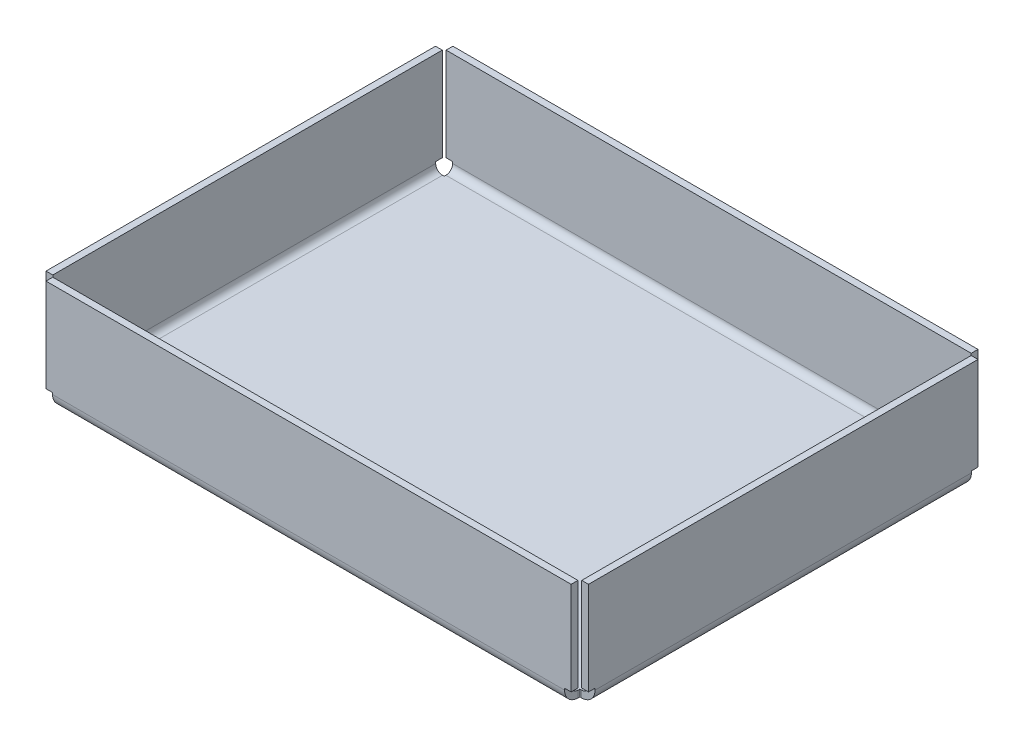
from build123d import *

# Parameters (mm, degrees)
SKETCH1_W              = 400
SKETCH1_H              = 300
BOSS_EXTRUDE1_DEPTH    = 80
SHELL1_T               = -5
CONVERT_SOLID1_START   = -200
CONVERT_SOLID1_DEPTH   = 400
CONVERT_SOLID1_2_DEPTH = 6.414213562
CONVERT_SOLID1_START_2 = 193.585786438
CONVERT_SOLID1_3_DEPTH = 6.414213562
CONVERT_SOLID1_START_3 = -193.585786438
CONVERT_SOLID1_4_DEPTH = 4.835786438
CONVERT_SOLID1_START_4 = 188.75
CONVERT_SOLID1_5_DEPTH = 4.835786438
CONVERT_SOLID1_START_5 = -188.75
CONVERT_SOLID1_6_DEPTH = 377.5
CONVERT_SOLID1_START_6 = -138.75
CONVERT_SOLID1_7_DEPTH = 277.5
CONVERT_SOLID1_8_DEPTH = 277.5


with BuildPart() as part:
    # Sketch1 → Boss-Extrude1 (new body)
    with BuildSketch(Plane(origin=(0, 0, 0), x_dir=(1, 0, 0), z_dir=(0, 1, 0))):
        Rectangle(SKETCH1_W, SKETCH1_H)
    extrude(amount=BOSS_EXTRUDE1_DEPTH)

    # Shell1
    shell1_openings = [part.faces().sort_by_distance(p)[0] for p in [
        (0, 80, 0),
    ]]
    offset(amount=SHELL1_T, openings=shell1_openings, kind=Kind.INTERSECTION)

    # Convert-Solid1: read off the stored shape, not the designer's step
    # Convert-Solid1 outline → Convert-Solid1 (cut)
    with BuildSketch(Plane.YZ.offset(CONVERT_SOLID1_START)):
        with BuildLine():
            Line((11.25, -138.75), (5, -138.75))
            Line((5, -138.75), (5, -140))
            ThreePointArc((5, -140), (6.464466094, -143.535533906), (10, -145))
            Line((10, -145), (80, -145))
            Line((80, -145), (80, -143.585786438))
            Line((80, -143.585786438), (11.25, -143.585786438))
            Line((11.25, -143.585786438), (11.25, -138.75))
        make_face()
        with BuildLine():
            Line((5, 140), (5, 138.75))
            Line((5, 138.75), (11.25, 138.75))
            Line((11.25, 138.75), (11.25, 143.585786438))
            Line((11.25, 143.585786438), (80, 143.585786438))
            Line((80, 143.585786438), (80, 145))
            Line((80, 145), (10, 145))
            ThreePointArc((10, 145), (6.464466094, 143.535533906), (5, 140))
        make_face()
        with BuildLine():
            ThreePointArc((10, -150), (2.928932188, -147.071067812), (0, -140))
            Line((0, -140), (0, -150))
            Line((0, -150), (10, -150))
        make_face()
        with BuildLine():
            Line((0, 150), (0, 140))
            ThreePointArc((0, 140), (2.928932188, 147.071067812), (10, 150))
            Line((10, 150), (0, 150))
        make_face()
    extrude(amount=CONVERT_SOLID1_DEPTH, mode=Mode.SUBTRACT)

    # Convert-Solid1 2 outline → Convert-Solid1 2 (cut)
    with BuildSketch(Plane.YZ.offset(CONVERT_SOLID1_START)):
        with BuildLine():
            Line((5, -140), (5, -138.75))
            Line((5, -138.75), (0, -138.75))
            Line((0, -138.75), (0, -140))
            ThreePointArc((0, -140), (2.928932188, -147.071067812), (10, -150))
            Line((10, -150), (80, -150))
            Line((80, -150), (80, -145))
            Line((80, -145), (10, -145))
            ThreePointArc((10, -145), (6.464466094, -143.535533906), (5, -140))
        make_face()
        with BuildLine():
            Line((0, 138.75), (5, 138.75))
            Line((5, 138.75), (5, 140))
            ThreePointArc((5, 140), (6.464466094, 143.535533906), (10, 145))
            Line((10, 145), (80, 145))
            Line((80, 145), (80, 150))
            Line((80, 150), (10, 150))
            ThreePointArc((10, 150), (2.928932188, 147.071067812), (0, 140))
            Line((0, 140), (0, 138.75))
        make_face()
    extrude(amount=CONVERT_SOLID1_2_DEPTH, mode=Mode.SUBTRACT)

    # Convert-Solid1 3 outline → Convert-Solid1 3 (cut)
    with BuildSketch(Plane.YZ.offset(CONVERT_SOLID1_START_2)):
        with BuildLine():
            Line((5, -140), (5, -138.75))
            Line((5, -138.75), (0, -138.75))
            Line((0, -138.75), (0, -140))
            ThreePointArc((0, -140), (2.928932188, -147.071067812), (10, -150))
            Line((10, -150), (80, -150))
            Line((80, -150), (80, -145))
            Line((80, -145), (10, -145))
            ThreePointArc((10, -145), (6.464466094, -143.535533906), (5, -140))
        make_face()
        with BuildLine():
            Line((0, 138.75), (5, 138.75))
            Line((5, 138.75), (5, 140))
            ThreePointArc((5, 140), (6.464466094, 143.535533906), (10, 145))
            Line((10, 145), (80, 145))
            Line((80, 145), (80, 150))
            Line((80, 150), (10, 150))
            ThreePointArc((10, 150), (2.928932188, 147.071067812), (0, 140))
            Line((0, 140), (0, 138.75))
        make_face()
    extrude(amount=CONVERT_SOLID1_3_DEPTH, mode=Mode.SUBTRACT)

    # Convert-Solid1 4 outline → Convert-Solid1 4 (cut)
    with BuildSketch(Plane.YZ.offset(CONVERT_SOLID1_START_3)):
        with BuildLine():
            Line((5, -145), (5, -138.75))
            Line((5, -138.75), (0, -138.75))
            Line((0, -138.75), (0, -140))
            ThreePointArc((0, -140), (2.928932188, -147.071067812), (10, -150))
            Line((10, -150), (11.25, -150))
            Line((11.25, -150), (11.25, -145))
            Line((11.25, -145), (5, -145))
        make_face()
        with BuildLine():
            Line((0, 138.75), (5, 138.75))
            Line((5, 138.75), (5, 145))
            Line((5, 145), (11.25, 145))
            Line((11.25, 145), (11.25, 150))
            Line((11.25, 150), (10, 150))
            ThreePointArc((10, 150), (2.928932188, 147.071067812), (0, 140))
            Line((0, 140), (0, 138.75))
        make_face()
    extrude(amount=CONVERT_SOLID1_4_DEPTH, mode=Mode.SUBTRACT)

    # Convert-Solid1 5 outline → Convert-Solid1 5 (cut)
    with BuildSketch(Plane.YZ.offset(CONVERT_SOLID1_START_4)):
        with BuildLine():
            Line((5, -145), (5, -138.75))
            Line((5, -138.75), (0, -138.75))
            Line((0, -138.75), (0, -140))
            ThreePointArc((0, -140), (2.928932188, -147.071067812), (10, -150))
            Line((10, -150), (11.25, -150))
            Line((11.25, -150), (11.25, -145))
            Line((11.25, -145), (5, -145))
        make_face()
        with BuildLine():
            Line((0, 138.75), (5, 138.75))
            Line((5, 138.75), (5, 145))
            Line((5, 145), (11.25, 145))
            Line((11.25, 145), (11.25, 150))
            Line((11.25, 150), (10, 150))
            ThreePointArc((10, 150), (2.928932188, 147.071067812), (0, 140))
            Line((0, 140), (0, 138.75))
        make_face()
    extrude(amount=CONVERT_SOLID1_5_DEPTH, mode=Mode.SUBTRACT)

    # Convert-Solid1 6 outline → Convert-Solid1 6 (add)
    with BuildSketch(Plane.YZ.offset(CONVERT_SOLID1_START_5)):
        with BuildLine():
            ThreePointArc((10, -145), (6.464466094, -143.535533906), (5, -140))
            Line((5, -140), (5, -145))
            Line((5, -145), (10, -145))
        make_face()
        with BuildLine():
            Line((5, 145), (5, 140))
            ThreePointArc((5, 140), (6.464466094, 143.535533906), (10, 145))
            Line((10, 145), (5, 145))
        make_face()
    extrude(amount=CONVERT_SOLID1_6_DEPTH)

    # Convert-Solid1 7 outline → Convert-Solid1 7 (cut)
    with BuildSketch(Plane.XY.offset(CONVERT_SOLID1_START_6)):
        with BuildLine():
            ThreePointArc((200, 10), (197.071067812, 2.928932188), (190, 0))
            Line((190, 0), (200, 0))
            Line((200, 0), (200, 10))
        make_face()
        with BuildLine():
            ThreePointArc((-190, 0), (-197.071067812, 2.928932188), (-200, 10))
            Line((-200, 10), (-200, 0))
            Line((-200, 0), (-190, 0))
        make_face()
    extrude(amount=CONVERT_SOLID1_7_DEPTH, mode=Mode.SUBTRACT)

    # Convert-Solid1 8 outline → Convert-Solid1 8 (add)
    with BuildSketch(Plane.XY.offset(CONVERT_SOLID1_START_6)):
        with BuildLine():
            ThreePointArc((195, 10), (193.535533906, 6.464466094), (190, 5))
            Line((190, 5), (195, 5))
            Line((195, 5), (195, 10))
        make_face()
        with BuildLine():
            ThreePointArc((-190, 5), (-193.535533906, 6.464466094), (-195, 10))
            Line((-195, 10), (-195, 5))
            Line((-195, 5), (-190, 5))
        make_face()
    extrude(amount=CONVERT_SOLID1_8_DEPTH)


solid = part.part
